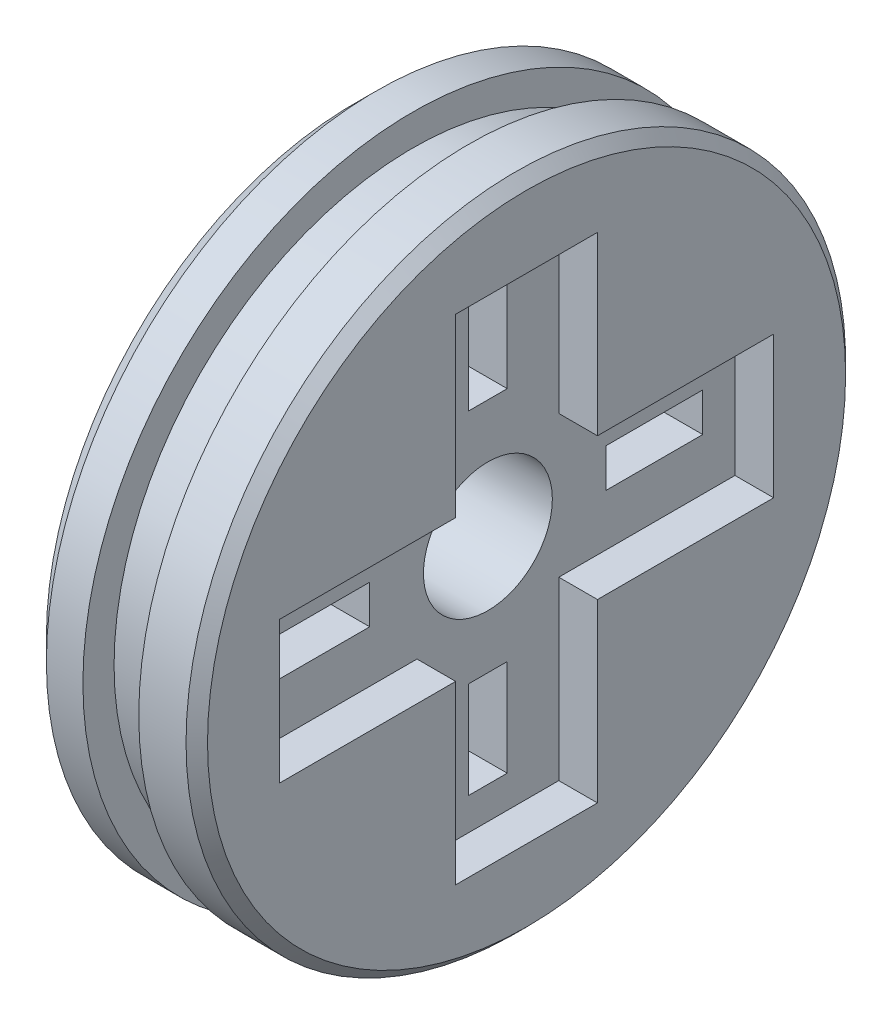
from build123d import *

# Parameters (mm, degrees)
SKETCH2_W            = 2.6
SKETCH2_H            = 2.45
BOSS_EXTRUDE1_START  = -55.3
SKETCH3_W            = 2.3
SKETCH3_H            = 23
BOSS_EXTRUDE1_DEPTH  = 6.6
BOSS_EXTRUDE2_START  = -63.5
SKETCH4_W            = 2.3
SKETCH4_H            = 6.6
BOSS_EXTRUDE2_DEPTH  = 23
BOSS_EXTRUDE3_START  = -79
SKETCH5_R            = 4.6
BOSS_EXTRUDE3_DEPTH  = 2.3
BOSS_EXTRUDE4_START  = -85.7
SKETCH6_R            = 7.1
BOSS_EXTRUDE4_DEPTH  = 1.7
BOSS_EXTRUDE5_START  = -84.1
SKETCH7_R            = 3
BOSS_EXTRUDE5_DEPTH  = 5.2
BOSS_EXTRUDE6_START  = -52.9
SKETCH8_W            = 4.1
SKETCH8_H            = 2.1
BOSS_EXTRUDE6_DEPTH  = 1.8
BOSS_EXTRUDE7_START  = -46.5
SKETCH9_W            = 4.1
SKETCH9_H            = 1.8
BOSS_EXTRUDE7_DEPTH  = 2.1
BOSS_EXTRUDE8_START  = -52.9
SKETCH10_W           = 4.1
SKETCH10_H           = 2.1
BOSS_EXTRUDE8_DEPTH  = 1.8
BOSS_EXTRUDE9_START  = -59.6
SKETCH11_W           = 4.1
SKETCH11_H           = 1.8
BOSS_EXTRUDE9_DEPTH  = 2.1
BOSS_EXTRUDE10_START = -52.9
SKETCH12_W           = 5.3
SKETCH12_H           = 2.4
BOSS_EXTRUDE10_DEPTH = 1.8
BOSS_EXTRUDE11_START = -44.4
SKETCH13_W           = 5.3
SKETCH13_H           = 1.8
BOSS_EXTRUDE11_DEPTH = 2.4
BOSS_EXTRUDE12_START = -52.9
SKETCH14_W           = 5.3
SKETCH14_H           = 2.4
BOSS_EXTRUDE12_DEPTH = 1.8
BOSS_EXTRUDE13_START = -62
SKETCH15_W           = 5.3
SKETCH15_H           = 1.8
BOSS_EXTRUDE13_DEPTH = 2.4


with BuildPart() as part:
    # Sketch1 → Revolve1 (revolve)
    with BuildSketch(Plane.XY.offset(-52)):
        Polygon((-77.2, -65), (-85.2, -65), (-85.2, -50.65), (-84.2, -49.65), (-77.7, -49.65), (-77.2, -50.15), align=None)
    revolve(axis=Axis((-90.2, -65, -52), (1, 0, 0)))


with BuildPart() as body_2:
    # Sketch2 → Revolve2 (revolve)
    with BuildSketch(Plane.XY.offset(-52)):
        with Locations((-81.2, -49.875)):
            Rectangle(SKETCH2_W, SKETCH2_H)
    revolve(axis=Axis((-87.5, -65, -52), (1, 0, 0)))


with BuildPart() as part_1:
    add(part.part)

    # Combine1: cut body 2
    add(body_2.part, mode=Mode.SUBTRACT)


with BuildPart() as body_2_2:
    # Sketch3 → Boss-Extrude1 (new body)
    with BuildSketch(Plane.XY.offset(BOSS_EXTRUDE1_START)):
        with Locations((-77.85, -65)):
            Rectangle(SKETCH3_W, SKETCH3_H)
    extrude(amount=BOSS_EXTRUDE1_DEPTH)


with BuildPart() as part_2:
    add(part_1.part)

    # Combine2: cut body 2 2
    add(body_2_2.part, mode=Mode.SUBTRACT)


with BuildPart() as body_2_3:
    # Sketch4 → Boss-Extrude2 (new body)
    with BuildSketch(Plane.XY.offset(BOSS_EXTRUDE2_START)):
        with Locations((-77.85, -65)):
            Rectangle(SKETCH4_W, SKETCH4_H)
    extrude(amount=BOSS_EXTRUDE2_DEPTH)


with BuildPart() as part_3:
    add(part_2.part)

    # Combine3: cut body 2 3
    add(body_2_3.part, mode=Mode.SUBTRACT)


with BuildPart() as body_2_4:
    # Sketch5 → Boss-Extrude3 (new body)
    with BuildSketch(Plane(origin=(0, 0, 0), x_dir=(0, 0, -1), z_dir=(1, 0, 0)).offset(BOSS_EXTRUDE3_START)):
        with Locations((52, -65)):
            Circle(SKETCH5_R)
    extrude(amount=BOSS_EXTRUDE3_DEPTH)


with BuildPart() as part_4:
    add(part_3.part)

    # Combine4: cut body 2 4
    add(body_2_4.part, mode=Mode.SUBTRACT)


with BuildPart() as body_2_5:
    # Sketch6 → Boss-Extrude4 (new body)
    with BuildSketch(Plane(origin=(0, 0, 0), x_dir=(0, 0, -1), z_dir=(1, 0, 0)).offset(BOSS_EXTRUDE4_START)):
        with Locations((52, -65)):
            Circle(SKETCH6_R)
    extrude(amount=BOSS_EXTRUDE4_DEPTH)


with BuildPart() as part_5:
    add(part_4.part)

    # Combine5: cut body 2 5
    add(body_2_5.part, mode=Mode.SUBTRACT)


with BuildPart() as body_2_6:
    # Sketch7 → Boss-Extrude5 (new body)
    with BuildSketch(Plane(origin=(0, 0, 0), x_dir=(0, 0, -1), z_dir=(1, 0, 0)).offset(BOSS_EXTRUDE5_START)):
        with Locations((52, -65)):
            Circle(SKETCH7_R)
    extrude(amount=BOSS_EXTRUDE5_DEPTH)


with BuildPart() as part_6:
    add(part_5.part)

    # Combine6: cut body 2 6
    add(body_2_6.part, mode=Mode.SUBTRACT)


with BuildPart() as body_2_7:
    # Sketch8 → Boss-Extrude6 (new body)
    with BuildSketch(Plane.XY.offset(BOSS_EXTRUDE6_START)):
        with Locations((-80.95, -58.45)):
            Rectangle(SKETCH8_W, SKETCH8_H)
    extrude(amount=BOSS_EXTRUDE6_DEPTH)


with BuildPart() as part_7:
    add(part_6.part)

    # Combine7: cut body 2 7
    add(body_2_7.part, mode=Mode.SUBTRACT)


with BuildPart() as body_2_8:
    # Sketch9 → Boss-Extrude7 (new body)
    with BuildSketch(Plane.XY.offset(BOSS_EXTRUDE7_START)):
        with Locations((-80.95, -65)):
            Rectangle(SKETCH9_W, SKETCH9_H)
    extrude(amount=BOSS_EXTRUDE7_DEPTH)


with BuildPart() as part_8:
    add(part_7.part)

    # Combine8: cut body 2 8
    add(body_2_8.part, mode=Mode.SUBTRACT)


with BuildPart() as body_2_9:
    # Sketch10 → Boss-Extrude8 (new body)
    with BuildSketch(Plane.XY.offset(BOSS_EXTRUDE8_START)):
        with Locations((-80.95, -71.55)):
            Rectangle(SKETCH10_W, SKETCH10_H)
    extrude(amount=BOSS_EXTRUDE8_DEPTH)


with BuildPart() as part_9:
    add(part_8.part)

    # Combine9: cut body 2 9
    add(body_2_9.part, mode=Mode.SUBTRACT)


with BuildPart() as body_2_10:
    # Sketch11 → Boss-Extrude9 (new body)
    with BuildSketch(Plane.XY.offset(BOSS_EXTRUDE9_START)):
        with Locations((-80.95, -65)):
            Rectangle(SKETCH11_W, SKETCH11_H)
    extrude(amount=BOSS_EXTRUDE9_DEPTH)


with BuildPart() as part_10:
    add(part_9.part)

    # Combine10: cut body 2 10
    add(body_2_10.part, mode=Mode.SUBTRACT)


with BuildPart() as body_2_11:
    # Sketch12 → Boss-Extrude10 (new body)
    with BuildSketch(Plane.XY.offset(BOSS_EXTRUDE10_START)):
        with Locations((-81.55, -56.2)):
            Rectangle(SKETCH12_W, SKETCH12_H)
    extrude(amount=BOSS_EXTRUDE10_DEPTH)


with BuildPart() as part_11:
    add(part_10.part)

    # Combine11: cut body 2 11
    add(body_2_11.part, mode=Mode.SUBTRACT)


with BuildPart() as body_2_12:
    # Sketch13 → Boss-Extrude11 (new body)
    with BuildSketch(Plane.XY.offset(BOSS_EXTRUDE11_START)):
        with Locations((-81.55, -65)):
            Rectangle(SKETCH13_W, SKETCH13_H)
    extrude(amount=BOSS_EXTRUDE11_DEPTH)


with BuildPart() as part_12:
    add(part_11.part)

    # Combine12: cut body 2 12
    add(body_2_12.part, mode=Mode.SUBTRACT)


with BuildPart() as body_2_13:
    # Sketch14 → Boss-Extrude12 (new body)
    with BuildSketch(Plane.XY.offset(BOSS_EXTRUDE12_START)):
        with Locations((-81.55, -73.8)):
            Rectangle(SKETCH14_W, SKETCH14_H)
    extrude(amount=BOSS_EXTRUDE12_DEPTH)


with BuildPart() as part_13:
    add(part_12.part)

    # Combine13: cut body 2 13
    add(body_2_13.part, mode=Mode.SUBTRACT)


with BuildPart() as body_2_14:
    # Sketch15 → Boss-Extrude13 (new body)
    with BuildSketch(Plane.XY.offset(BOSS_EXTRUDE13_START)):
        with Locations((-81.55, -65)):
            Rectangle(SKETCH15_W, SKETCH15_H)
    extrude(amount=BOSS_EXTRUDE13_DEPTH)


with BuildPart() as part_14:
    add(part_13.part)

    # Combine14: cut body 2 14
    add(body_2_14.part, mode=Mode.SUBTRACT)


solid = part_14.part
